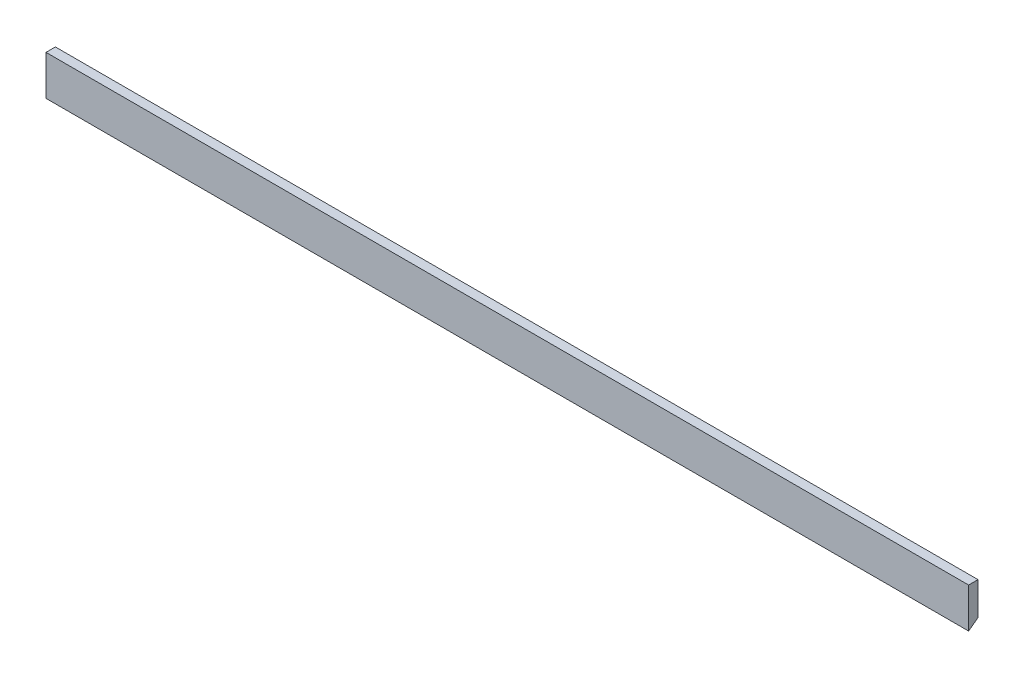
from build123d import *

# Parameters (mm, degrees)
SKETCH2_W           = 3.175
SKETCH2_H           = 13.49
BOSS_EXTRUDE1_DEPTH = 312.1
CHAMFER1_SIZE       = 2.349376413
CHAMFER1_SIZE_2     = 3.175


with BuildPart() as part:
    # Sketch2 → Boss-Extrude1 (new body)
    with BuildSketch(Plane(origin=(0, 0, 0), x_dir=(0, 0, -1), z_dir=(1, 0, 0))):
        Rectangle(SKETCH2_W, SKETCH2_H)
    extrude(amount=BOSS_EXTRUDE1_DEPTH)

    # Chamfer1
    # the kernel refuses this chamfer: 3.175, 2.349376413 mm, written as the material it takes off along each edge
    with BuildSketch(Plane(origin=(-8.194900993, -6.745, -1.5875), x_dir=(0, 0.9991149585695113, -0.0420630427173772), z_dir=(1, 0, 0))) as chamfer1_piece_1:
        Polygon((CHAMFER1_SIZE * 0.999114958661, CHAMFER1_SIZE * 0.0420630427212), (-CHAMFER1_SIZE_2 * 0.0420630427174, CHAMFER1_SIZE_2 * 0.99911495857), (0, 0), align=None)
    extrude(amount=328.489801986, mode=Mode.SUBTRACT)


solid = part.part
